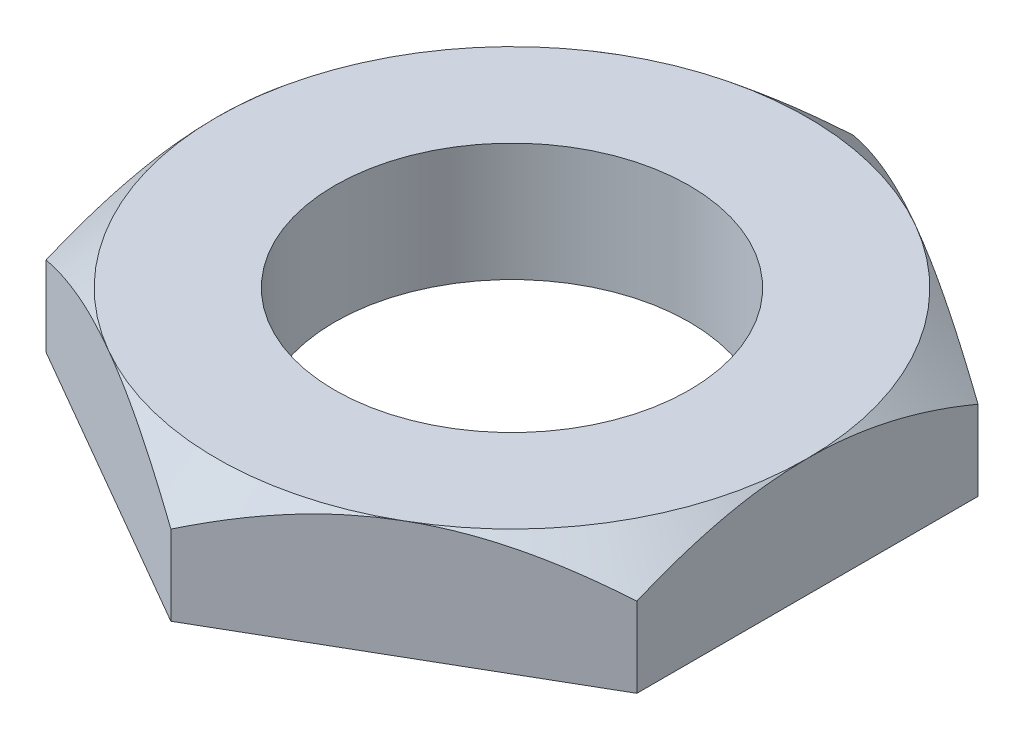
from build123d import *

# Parameters (mm, degrees)
SKETCH1_R           = 3
BOSS_EXTRUDE1_DEPTH = 2


# Read off the part's stored shape, not the designer's step: Cut-Extrude2
with BuildPart() as part:
    # Sketch1 → Boss-Extrude1 (new body)
    with BuildSketch(Plane(origin=(0, 0, 0), x_dir=(1, 0, 0), z_dir=(0, 1, 0))):
        Polygon((0, -5.773502692), (5, -2.886751346), (5, 2.886751346), (0, 5.773502692), (-5, 2.886751346), (-5, -2.886751346), align=None)
        with Locations(Location((0, 0, 0), (0, 0, 270))):
            Circle(SKETCH1_R, mode=Mode.SUBTRACT)
    extrude(amount=BOSS_EXTRUDE1_DEPTH)

    # Cut-Extrude2 outline → Cut-Extrude2 (revolve, cut)
    with BuildSketch(Plane.XY):
        Polygon((5.773502708, 2), (5, 2), (5.773502708, 1.350954163), align=None)
    revolve(axis=Axis((0, 0, 0), (0, 1, 0)), mode=Mode.SUBTRACT)


solid = part.part
